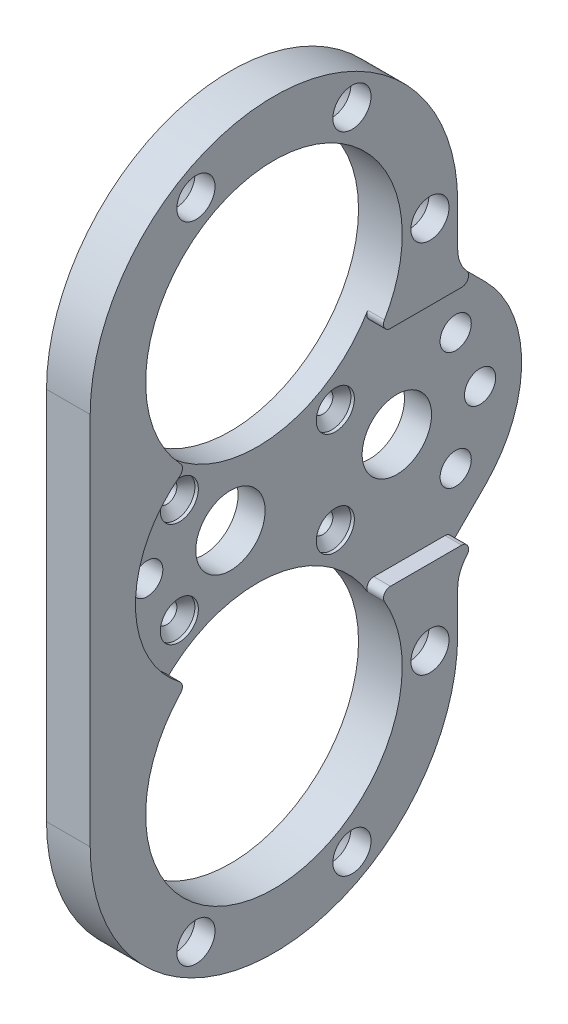
from build123d import *

# Parameters (mm, degrees)
BOSS_EXTRUDE1_DEPTH     = 4
MOVE_FACE4_BY           = 2.5
CIRPATTERN1_COUNT       = 6
CUT_EXTRUDE1_DEPTH      = 70.81610106
CUT_EXTRUDE1_DEPTH_BACK = 66.81610106
CUT_EXTRUDE1_START      = -4
SKETCH9_R               = 5
M4_CLEARANCE_HOLE1_D    = 4.5
CUT_EXTRUDE3_DEPTH      = 66.81610106
CUT_EXTRUDE3_DEPTH_BACK = 66.81610106
SKETCH11_R              = 18.5
CUT_EXTRUDE4_DEPTH      = 66.81610106
MOVE_FACE3_BY           = 0.1
MOVE_FACE3_2_BY         = 0.1
FILLET1_R               = 1
MOVE_FACE1_BY           = 0.1
MOVE_FACE1_2_BY         = 0.1


with BuildPart() as part:
    # Sketch2 → Boss-Extrude1 (new body)
    with BuildSketch(Plane.YZ):
        with BuildLine():
            Line((-12.727922061, -32.852837258), (-17.616293225, -27.964466094))
            ThreePointArc((-17.616293225, -27.964466094), (-19.238409969, -26.880602337), (-21.151827131, -26.5))
            Line((-21.151827131, -26.5), (-27, -26.5))
            ThreePointArc((-27, -26.5), (-53.5, 0), (-27, 26.5))
            Line((-27, 26.5), (0, 26.5))
            Line((0, 26.5), (0, -38.124915197))
            ThreePointArc((0, -38.124915197), (-6.888301783, -36.754746782), (-12.727922061, -32.852837258))
        make_face()
    extrude(amount=-BOSS_EXTRUDE1_DEPTH)

    # Move Face4: a face moved outward by 2.5
    extrude(part.faces().sort_by_distance((0, -23.32621052, -1.71865324))[0], amount=MOVE_FACE4_BY, dir=(1, 0, 0))

    # Sketch18 → CSK for M2.5 Flat Head Machine Screw1 (revolve, cut)
    with BuildSketch(Plane(origin=(2.5, -46.485571585, 11.25), x_dir=(0, 0, -1), z_dir=(0, 1, 0))):
        Polygon((0, 0), (0, 6.5), (1.45, 6.5), (1.45, 4.3), (2.75, 3), (2.75, 0), align=None)
    csk_for_m2_5_flat_head_machine_screw1 = revolve(axis=Axis((8.85, -46.485571585, 11.25), (-1, 0, 0)), mode=Mode.SUBTRACT)

    # CirPattern1: CSK for M2.5 Flat Head Machine Screw1 ×6 about axis, 1 skipped
    cirpattern1_axis = Axis((0, -27, 0), (1, 0, 0))
    add([csk_for_m2_5_flat_head_machine_screw1.rotate(cirpattern1_axis, i * 360 / CIRPATTERN1_COUNT) for i in range(1, CIRPATTERN1_COUNT) if i not in (5,)], mode=Mode.SUBTRACT)

    # Sketch9 → Cut-Extrude1 (cut, two sides: drawn at the far end of the back side and taken through both)
    with BuildSketch(Plane.YZ.offset(CUT_EXTRUDE1_START - CUT_EXTRUDE1_DEPTH_BACK)):
        with Locations((0, 3.875084803)):
            Circle(SKETCH9_R)
        with Locations((0, -20.124915197)):
            Circle(SKETCH9_R)
    extrude(amount=CUT_EXTRUDE1_DEPTH + CUT_EXTRUDE1_DEPTH_BACK, mode=Mode.SUBTRACT)

    # M4 Clearance Hole1 (through all)
    with Locations(Plane.ZY.offset(4)):
        with Locations((15.875084803, 0), (-28.610196571, -8.485281374), (-32.124915197, 0)):
            Hole(M4_CLEARANCE_HOLE1_D / 2)

    # Sketch11 → Cut-Extrude3 (cut, two sides: drawn at the far end of the back side and taken through both)
    with BuildSketch(Plane.YZ.offset(-CUT_EXTRUDE3_DEPTH_BACK)):
        with Locations(Location((-27, 0, 0), (0, 0, 270))):
            Circle(SKETCH11_R)
    extrude(amount=CUT_EXTRUDE3_DEPTH + CUT_EXTRUDE3_DEPTH_BACK, mode=Mode.SUBTRACT)

    # Sketch14 → Cut-Extrude4 (cut, through all)
    with BuildSketch(Plane.YZ):
        with BuildLine():
            Line((16, 3.875084803), (16, -92.124915197))
            ThreePointArc((16, -92.124915197), (0, -108.124915197), (-16, -92.124915197))
            Line((-16, -92.124915197), (-16, 3.875084803))
            ThreePointArc((-16, 3.875084803), (0, 19.875084803), (16, 3.875084803))
        make_face()
    extrude(amount=CUT_EXTRUDE4_DEPTH, mode=Mode.SUBTRACT)

    # Move Face3: a face moved inward by 0.1
    extrude(part.faces().sort_by_distance((1.25, -16, -22.22761705))[0], amount=MOVE_FACE3_BY, dir=(0, -1, 0), mode=Mode.SUBTRACT)

    # Move Face3 2: a curved face moved inward by 0.1
    add(Solid.thicken(part.faces().sort_by_distance((1.25, -7.643007581, 17.931557871))[0], -MOVE_FACE3_2_BY), mode=Mode.SUBTRACT)

    # Fillet1
    # the kernel refuses this fillet: 1 mm, written as the material it takes off along each edge
    with BuildSketch(Plane(origin=(8.514983565, -16.1, -29.480759319), x_dir=(0, -0.7085538921245894, 0.7056567026218171), z_dir=(-1, 0, 0))) as fillet1_piece_1:
        with BuildLine():
            CenterArc((2.40635928, 0.999119304), FILLET1_R, 135.117377496, 132.477802543)
            Line((1.697805388, 1.704776006), (1.626949998, 1.775341677))
            Line((1.626949998, 1.775341677), (-0.070855389, 0.07056567))
            Line((-0.070855389, 0.07056567), (0.000204862, -0.09999979))
            ThreePointArc((0.000204862, -0.09999979), (2.144562806, -0.095606801), (2.360203605, -0.09991193))
            Line((2.360203605, -0.09991193), (2.364399576, 0))
        make_face()
    extrude(amount=8.514983565, mode=Mode.SUBTRACT)
    with BuildSketch(Plane(origin=(7.130226118, -16.1, -14.947909553), x_dir=(3.712378047995727e-15, -0.8357607449815292, -0.5490937780998063), z_dir=(-1, 0, 0))) as fillet1_piece_2:
        with BuildLine():
            CenterArc((1.852732086, -0.998810714), FILLET1_R, 92.794627145, 120.510237406)
            Line((1.016971341, -1.547904492), (0, 0))
            ThreePointArc((0, 0), (0.901987989, -0.022001795), (1.803975978, 0))
        make_face()
    extrude(amount=7.130226118, mode=Mode.SUBTRACT)
    with BuildSketch(Plane(origin=(5.398868608, -13.499485451, 12.648561456), x_dir=(-5.5330585224254415e-15, 0.5746651545031678, 0.8183886364068421), z_dir=(-1, 0, 0))) as fillet1_piece_3:
        with BuildLine():
            CenterArc((1.191014528, -0.999356323), FILLET1_R, 92.055865996, 96.142233036)
            ThreePointArc((0.201233565, -1.141952418), (0.109565926, -0.569399201), (0, 0))
            ThreePointArc((0, 0), (0.577570298, -0.010363194), (1.155140596, 0))
        make_face()
    extrude(amount=5.398868608, mode=Mode.SUBTRACT)

    # Move Face1: a face moved inward by 0.1
    extrude(part.faces().sort_by_distance((-4, -26.75, 20.03750848))[0], amount=MOVE_FACE1_BY, dir=(1, 0, 0), mode=Mode.SUBTRACT)

    # Move Face1 2: a face moved inward by 0.1
    extrude(part.faces().sort_by_distance((2.5, -26.75, 21.042523411))[0], amount=MOVE_FACE1_2_BY, dir=(-1, 0, 0), mode=Mode.SUBTRACT)

    # Mirror1: part across plane


with BuildPart() as part_1:
    add(part.part)
    add(part.part.mirror(Plane(origin=(0, 0, 0), x_dir=(0, 0, 1), z_dir=(0, -1, 0))))


solid = part_1.part
